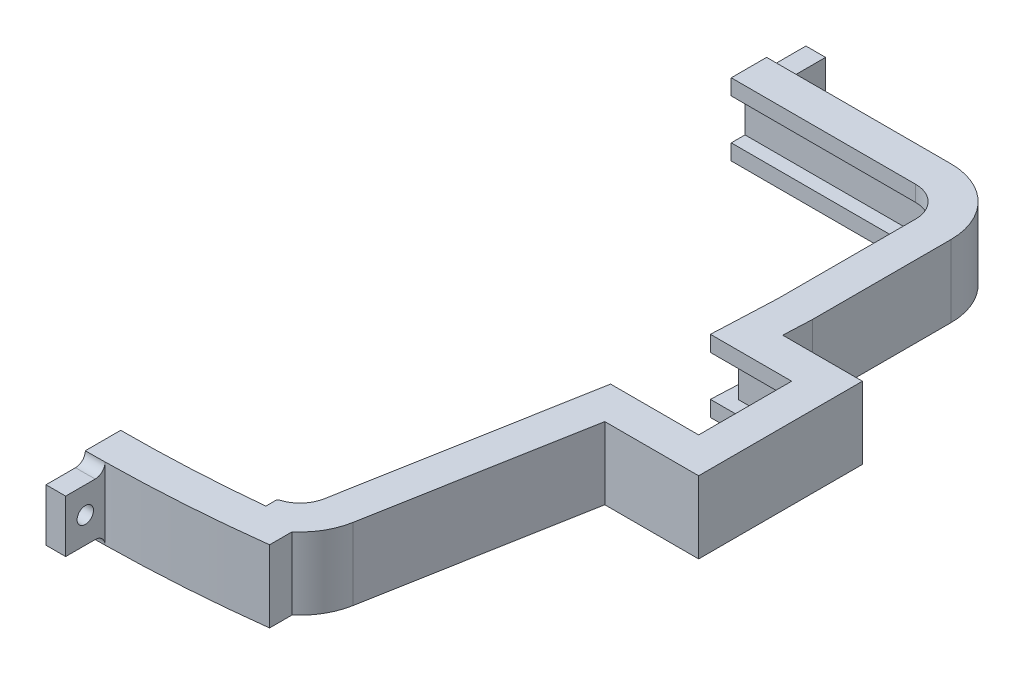
from build123d import *

# Parameters (mm, degrees)
BOSS_EXTRUDE1_DEPTH      = 4.5
CUT_EXTRUDE3_DEPTH       = 2.1
BOSS_EXTRUDE3_START      = 6.5
BOSS_EXTRUDE3_DEPTH      = 6.5
CUT_EXTRUDE4_START       = 4.1
CUT_EXTRUDE4_DEPTH       = 4.1
BOSS_EXTRUDE4_DEPTH      = 3
BOSS_EXTRUDE4_DEPTH_BACK = 3
SKETCH4_R                = 1.25
SKETCH4_W                = 6
SKETCH4_H                = 8
FILLET1_R                = 1.5
SKETCH5_W                = 150
SKETCH5_H                = 40
CUT_EXTRUDE5_DEPTH       = 79.451654949


with BuildPart() as part:
    # Sketch2 → Boss-Extrude1 (new body)
    with BuildSketch(Plane(origin=(0, 0, 0), x_dir=(1, 0, 0), z_dir=(0, 1, 0))):
        with BuildLine():
            Line((-28.15, 50), (28.15, 50))
            ThreePointArc((28.15, 50), (35.221067812, 47.071067812), (38.15, 40))
            Line((38.15, 40), (38.15, 18.869079534))
            Line((38.15, 18.869079534), (37.959241868, 14.5))
            Line((37.959241868, 14.5), (50.123967842, 14.5))
            Line((50.123967842, 14.5), (50.123967842, -10.5))
            Line((50.123967842, -10.5), (35.7933894, -10.5))
            Line((35.7933894, -10.5), (29.904245688, -43.067652969))
            ThreePointArc((29.904245688, -43.067652969), (28.715879749, -46.302425464), (26.5, -48.941713937))
            Line((26.5, -48.941713937), (26.5, -52.373001444))
            ThreePointArc((26.5, -52.373001444), (0, -54), (-26.5, -52.373001444))
            Line((-26.5, -52.373001444), (-26.5, -48.941713937))
            ThreePointArc((-26.5, -48.941713937), (-28.715879749, -46.302425464), (-29.904245688, -43.067652969))
            Line((-29.904245688, -43.067652969), (-35.7933894, -10.5))
            Line((-35.7933894, -10.5), (-50.123967842, -10.5))
            Line((-50.123967842, -10.5), (-50.123967842, 14.5))
            Line((-50.123967842, 14.5), (-37.959241868, 14.5))
            Line((-37.959241868, 14.5), (-38.15, 18.869079534))
            Line((-38.15, 18.869079534), (-38.15, 40))
            ThreePointArc((-38.15, 40), (-35.221067812, 47.071067812), (-28.15, 50))
        make_face()
        with BuildLine():
            Line((-32.75, 40), (-32.75, 18.986907953))
            Line((-32.75, 18.986907953), (-32.318328276, 9.1))
            Line((-32.318328276, 9.1), (-44.723967842, 9.1))
            Line((-44.723967842, 9.1), (-44.723967842, -5.1))
            Line((-44.723967842, -5.1), (-31.282284108, -5.1))
            Line((-31.282284108, -5.1), (-24.590424569, -42.106765297))
            ThreePointArc((-24.590424569, -42.106765297), (-23.494161062, -44.35301053), (-21.385106897, -45.694391107))
            ThreePointArc((-21.385106897, -45.694391107), (-21.179097179, -45.838743936), (-21.1, -46.077535434))
            Line((-21.1, -46.077535434), (-21.1, -47.543481521))
            ThreePointArc((-21.1, -47.543481521), (0, -48.6), (21.1, -47.543481521))
            Line((21.1, -47.543481521), (21.1, -46.077535434))
            ThreePointArc((21.1, -46.077535434), (21.179097179, -45.838743936), (21.385106897, -45.694391107))
            ThreePointArc((21.385106897, -45.694391107), (23.494161062, -44.35301053), (24.590424569, -42.106765297))
            Line((24.590424569, -42.106765297), (31.282284108, -5.1))
            Line((31.282284108, -5.1), (44.723967842, -5.1))
            Line((44.723967842, -5.1), (44.723967842, 9.1))
            Line((44.723967842, 9.1), (32.318328276, 9.1))
            Line((32.318328276, 9.1), (32.75, 18.986907953))
            Line((32.75, 18.986907953), (32.75, 40))
            ThreePointArc((32.75, 40), (31.402691193, 43.252691193), (28.15, 44.6))
            Line((28.15, 44.6), (-28.15, 44.6))
            ThreePointArc((-28.15, 44.6), (-31.402691193, 43.252691193), (-32.75, 40))
        make_face(mode=Mode.SUBTRACT)
    extrude(amount=-BOSS_EXTRUDE1_DEPTH)

    # Sketch2<6> → Cut-Extrude3 (cut)
    with BuildSketch(Plane(origin=(0, 0, 0), x_dir=(1, 0, 0), z_dir=(0, 1, 0))):
        with BuildLine():
            Line((-28.15, 46.7), (28.15, 46.7))
            ThreePointArc((28.15, 46.7), (32.887615434, 44.737615434), (34.85, 40))
            Line((34.85, 40), (34.85, 18.94108579))
            Line((34.85, 18.94108579), (34.512016895, 11.2))
            Line((34.512016895, 11.2), (46.823967842, 11.2))
            Line((46.823967842, 11.2), (46.823967842, -7.2))
            Line((46.823967842, -7.2), (33.036602833, -7.2))
            Line((33.036602833, -7.2), (26.656910559, -42.480443836))
            ThreePointArc((26.656910559, -42.480443836), (25.472544462, -45.242453785), (23.2, -47.208913466))
            Line((23.2, -47.208913466), (23.2, -49.434698257))
            ThreePointArc((23.2, -49.434698257), (0, -50.7), (-23.2, -49.434698257))
            Line((-23.2, -49.434698257), (-23.2, -47.208913466))
            ThreePointArc((-23.2, -47.208913466), (-25.472544462, -45.242453785), (-26.656910559, -42.480443836))
            Line((-26.656910559, -42.480443836), (-33.036602833, -7.2))
            Line((-33.036602833, -7.2), (-46.823967842, -7.2))
            Line((-46.823967842, -7.2), (-46.823967842, 11.2))
            Line((-46.823967842, 11.2), (-34.512016895, 11.2))
            Line((-34.512016895, 11.2), (-34.85, 18.94108579))
            Line((-34.85, 18.94108579), (-34.85, 40))
            ThreePointArc((-34.85, 40), (-32.887615434, 44.737615434), (-28.15, 46.7))
        make_face()
    extrude(amount=-CUT_EXTRUDE3_DEPTH, mode=Mode.SUBTRACT)

    # Sketch2<7> → Boss-Extrude3 (add)
    with BuildSketch(Plane(origin=(0, 0, 0), x_dir=(1, 0, 0), z_dir=(0, 1, 0)).offset(BOSS_EXTRUDE3_START)):
        with BuildLine():
            Line((28.15, 50), (-28.15, 50))
            ThreePointArc((-28.15, 50), (-35.221067812, 47.071067812), (-38.15, 40))
            Line((-38.15, 40), (-38.15, 18.869079534))
            Line((-38.15, 18.869079534), (-37.959241868, 14.5))
            Line((-37.959241868, 14.5), (-50.123967842, 14.5))
            Line((-50.123967842, 14.5), (-50.123967842, -10.5))
            Line((-50.123967842, -10.5), (-35.7933894, -10.5))
            Line((-35.7933894, -10.5), (-29.904245688, -43.067652969))
            ThreePointArc((-29.904245688, -43.067652969), (-28.715879749, -46.302425464), (-26.5, -48.941713937))
            Line((-26.5, -48.941713937), (-26.5, -52.373001444))
            ThreePointArc((-26.5, -52.373001444), (0, -54), (26.5, -52.373001444))
            Line((26.5, -52.373001444), (26.5, -48.941713937))
            ThreePointArc((26.5, -48.941713937), (28.715879749, -46.302425464), (29.904245688, -43.067652969))
            Line((29.904245688, -43.067652969), (35.7933894, -10.5))
            Line((35.7933894, -10.5), (50.123967842, -10.5))
            Line((50.123967842, -10.5), (50.123967842, 14.5))
            Line((50.123967842, 14.5), (37.959241868, 14.5))
            Line((37.959241868, 14.5), (38.15, 18.869079534))
            Line((38.15, 18.869079534), (38.15, 40))
            ThreePointArc((38.15, 40), (35.221067812, 47.071067812), (28.15, 50))
        make_face()
        with BuildLine():
            Line((-44.723967842, 9.1), (-32.318328276, 9.1))
            Line((-32.318328276, 9.1), (-32.75, 18.986907953))
            Line((-32.75, 18.986907953), (-32.75, 40))
            ThreePointArc((-32.75, 40), (-31.402691193, 43.252691193), (-28.15, 44.6))
            Line((-28.15, 44.6), (28.15, 44.6))
            ThreePointArc((28.15, 44.6), (31.402691193, 43.252691193), (32.75, 40))
            Line((32.75, 40), (32.75, 18.986907953))
            Line((32.75, 18.986907953), (32.318328276, 9.1))
            Line((32.318328276, 9.1), (44.723967842, 9.1))
            Line((44.723967842, 9.1), (44.723967842, -5.1))
            Line((44.723967842, -5.1), (31.282284108, -5.1))
            Line((31.282284108, -5.1), (24.590424569, -42.106765297))
            ThreePointArc((24.590424569, -42.106765297), (23.494161062, -44.35301053), (21.385106897, -45.694391107))
            ThreePointArc((21.385106897, -45.694391107), (21.179097179, -45.838743936), (21.1, -46.077535434))
            Line((21.1, -46.077535434), (21.1, -47.543481521))
            ThreePointArc((21.1, -47.543481521), (0, -48.6), (-21.1, -47.543481521))
            Line((-21.1, -47.543481521), (-21.1, -46.077535434))
            ThreePointArc((-21.1, -46.077535434), (-21.179097179, -45.838743936), (-21.385106897, -45.694391107))
            ThreePointArc((-21.385106897, -45.694391107), (-23.494161062, -44.35301053), (-24.590424569, -42.106765297))
            Line((-24.590424569, -42.106765297), (-31.282284108, -5.1))
            Line((-31.282284108, -5.1), (-44.723967842, -5.1))
            Line((-44.723967842, -5.1), (-44.723967842, 9.1))
        make_face(mode=Mode.SUBTRACT)
    extrude(amount=-BOSS_EXTRUDE3_DEPTH)

    # Sketch2<8> → Cut-Extrude4 (cut)
    with BuildSketch(Plane(origin=(0, 0, 0), x_dir=(1, 0, 0), z_dir=(0, 1, 0)).offset(CUT_EXTRUDE4_START)):
        with BuildLine():
            Line((28.15, 46.7), (-28.15, 46.7))
            ThreePointArc((-28.15, 46.7), (-32.887615434, 44.737615434), (-34.85, 40))
            Line((-34.85, 40), (-34.85, 18.94108579))
            Line((-34.85, 18.94108579), (-34.512016895, 11.2))
            Line((-34.512016895, 11.2), (-46.823967842, 11.2))
            Line((-46.823967842, 11.2), (-46.823967842, -7.2))
            Line((-46.823967842, -7.2), (-33.036602833, -7.2))
            Line((-33.036602833, -7.2), (-26.656910559, -42.480443836))
            ThreePointArc((-26.656910559, -42.480443836), (-25.472544462, -45.242453785), (-23.2, -47.208913466))
            Line((-23.2, -47.208913466), (-23.2, -49.434698257))
            ThreePointArc((-23.2, -49.434698257), (0, -50.7), (23.2, -49.434698257))
            Line((23.2, -49.434698257), (23.2, -47.208913466))
            ThreePointArc((23.2, -47.208913466), (25.472544462, -45.242453785), (26.656910559, -42.480443836))
            Line((26.656910559, -42.480443836), (33.036602833, -7.2))
            Line((33.036602833, -7.2), (46.823967842, -7.2))
            Line((46.823967842, -7.2), (46.823967842, 11.2))
            Line((46.823967842, 11.2), (34.512016895, 11.2))
            Line((34.512016895, 11.2), (34.85, 18.94108579))
            Line((34.85, 18.94108579), (34.85, 40))
            ThreePointArc((34.85, 40), (32.887615434, 44.737615434), (28.15, 46.7))
        make_face()
        with BuildLine():
            Line((-32.75, 18.986907953), (-32.75, 40))
            ThreePointArc((-32.75, 40), (-31.402691193, 43.252691193), (-28.15, 44.6))
            Line((-28.15, 44.6), (28.15, 44.6))
            ThreePointArc((28.15, 44.6), (31.402691193, 43.252691193), (32.75, 40))
            Line((32.75, 40), (32.75, 18.986907953))
            Line((32.75, 18.986907953), (32.318328276, 9.1))
            Line((32.318328276, 9.1), (44.723967842, 9.1))
            Line((44.723967842, 9.1), (44.723967842, -5.1))
            Line((44.723967842, -5.1), (31.282284108, -5.1))
            Line((31.282284108, -5.1), (24.590424569, -42.106765297))
            ThreePointArc((24.590424569, -42.106765297), (23.494161062, -44.35301053), (21.385106897, -45.694391107))
            ThreePointArc((21.385106897, -45.694391107), (21.179097179, -45.838743936), (21.1, -46.077535434))
            Line((21.1, -46.077535434), (21.1, -47.543481521))
            ThreePointArc((21.1, -47.543481521), (0, -48.6), (-21.1, -47.543481521))
            Line((-21.1, -47.543481521), (-21.1, -46.077535434))
            ThreePointArc((-21.1, -46.077535434), (-21.179097179, -45.838743936), (-21.385106897, -45.694391107))
            ThreePointArc((-21.385106897, -45.694391107), (-23.494161062, -44.35301053), (-24.590424569, -42.106765297))
            Line((-24.590424569, -42.106765297), (-31.282284108, -5.1))
            Line((-31.282284108, -5.1), (-44.723967842, -5.1))
            Line((-44.723967842, -5.1), (-44.723967842, 9.1))
            Line((-44.723967842, 9.1), (-32.318328276, 9.1))
            Line((-32.318328276, 9.1), (-32.75, 18.986907953))
        make_face(mode=Mode.SUBTRACT)
    extrude(amount=-CUT_EXTRUDE4_DEPTH, mode=Mode.SUBTRACT)

    # Sketch4 → Boss-Extrude4 (add, two sides: drawn at the far end of the back side and taken through both)
    # profile 1 of 2: a face of its own
    with BuildSketch(Plane(origin=(0, 0, 0), x_dir=(0, 0, -1), z_dir=(1, 0, 0)).offset(-BOSS_EXTRUDE4_DEPTH_BACK)):
        Polygon((-52, 5), (-52, -3), (-54, -3), (-60, -3), (-60, 5), (-54, 5), align=None)
        with Locations((-57, 1)):
            Circle(SKETCH4_R, mode=Mode.SUBTRACT)
    # profile 2 of 2: a face of its own
    with BuildSketch(Plane(origin=(0, 0, 0), x_dir=(0, 0, -1), z_dir=(1, 0, 0)).offset(-BOSS_EXTRUDE4_DEPTH_BACK)):
        with Locations((53, 1)):
            Rectangle(SKETCH4_W, SKETCH4_H)
        with Locations((53, 1)):
            Circle(SKETCH4_R, mode=Mode.SUBTRACT)
    extrude(amount=BOSS_EXTRUDE4_DEPTH + BOSS_EXTRUDE4_DEPTH_BACK)

    # Fillet1
    fillet1_edges = [part.edges().sort_by_distance(p)[0] for p in [
        (0, 5, 54),
        (0, -3, 54),
        (0, -3, -50),
        (0, 5, -50),
    ]]
    fillet(fillet1_edges, radius=FILLET1_R - 0.0001)  # a hair under: the kernel refuses the full size

    # Sketch5 → Cut-Extrude5 (cut, through all)
    with BuildSketch(Plane(origin=(0, 0, 0), x_dir=(0, 0, -1), z_dir=(1, 0, 0))):
        Rectangle(SKETCH5_W, SKETCH5_H)
    extrude(amount=-CUT_EXTRUDE5_DEPTH, mode=Mode.SUBTRACT)


solid = part.part
